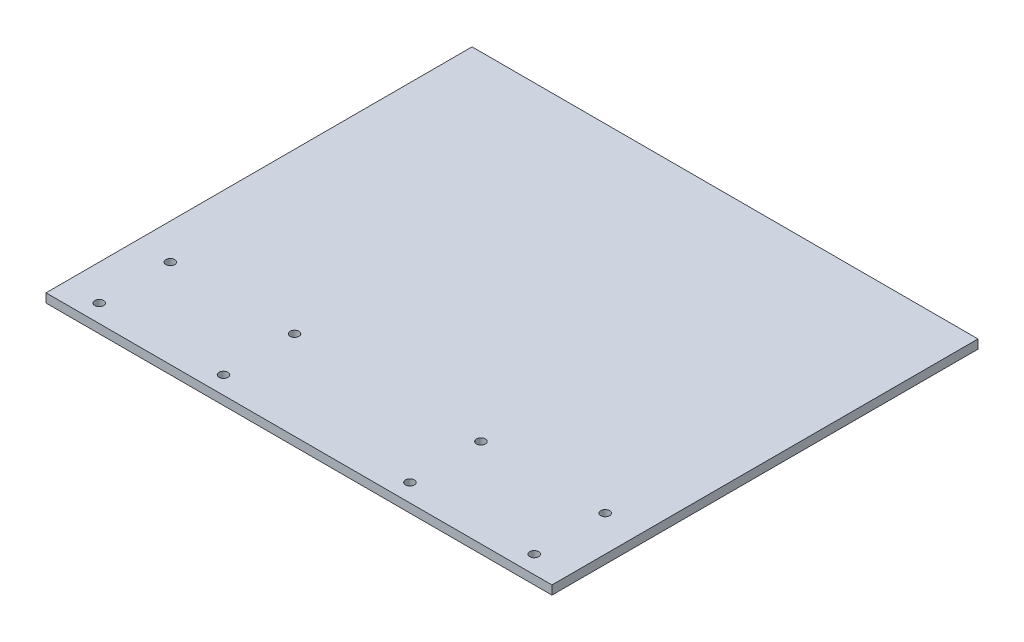
from build123d import *

# Parameters (mm, degrees)
SKETCH1_W           = 723.9
SKETCH1_H           = 609.6
BOSS_EXTRUDE1_DEPTH = 12.7
SKETCH2_R           = 6.35
CUT_EXTRUDE1_DEPTH  = 746.127720533


with BuildPart() as part:
    # Sketch1 → Boss-Extrude1 (new body)
    with BuildSketch(Plane(origin=(0, 0, 0), x_dir=(1, 0, 0), z_dir=(0, 1, 0))):
        with Locations((66.351143947, 304.8)):
            Rectangle(SKETCH1_W, SKETCH1_H)
    extrude(amount=BOSS_EXTRUDE1_DEPTH)

    # Sketch2 → Cut-Extrude1 (cut, through all)
    with BuildSketch(Plane(origin=(0, 12.7, 0), x_dir=(1, 0, 0), z_dir=(0, 1, 0))):
        with Locations((377.501143947, 127)):
            Circle(SKETCH2_R)
        with Locations((377.501143947, 25.4)):
            Circle(SKETCH2_R)
        with Locations((199.701143947, 127)):
            Circle(SKETCH2_R)
        with Locations((199.701143947, 25.4)):
            Circle(SKETCH2_R)
        with Locations((-244.798856053, 127)):
            Circle(SKETCH2_R)
        with Locations((-66.998856053, 127)):
            Circle(SKETCH2_R)
        with Locations((-244.798856053, 25.4)):
            Circle(SKETCH2_R)
        with Locations((-66.998856053, 25.4)):
            Circle(SKETCH2_R)
    extrude(amount=-CUT_EXTRUDE1_DEPTH, mode=Mode.SUBTRACT)


solid = part.part
